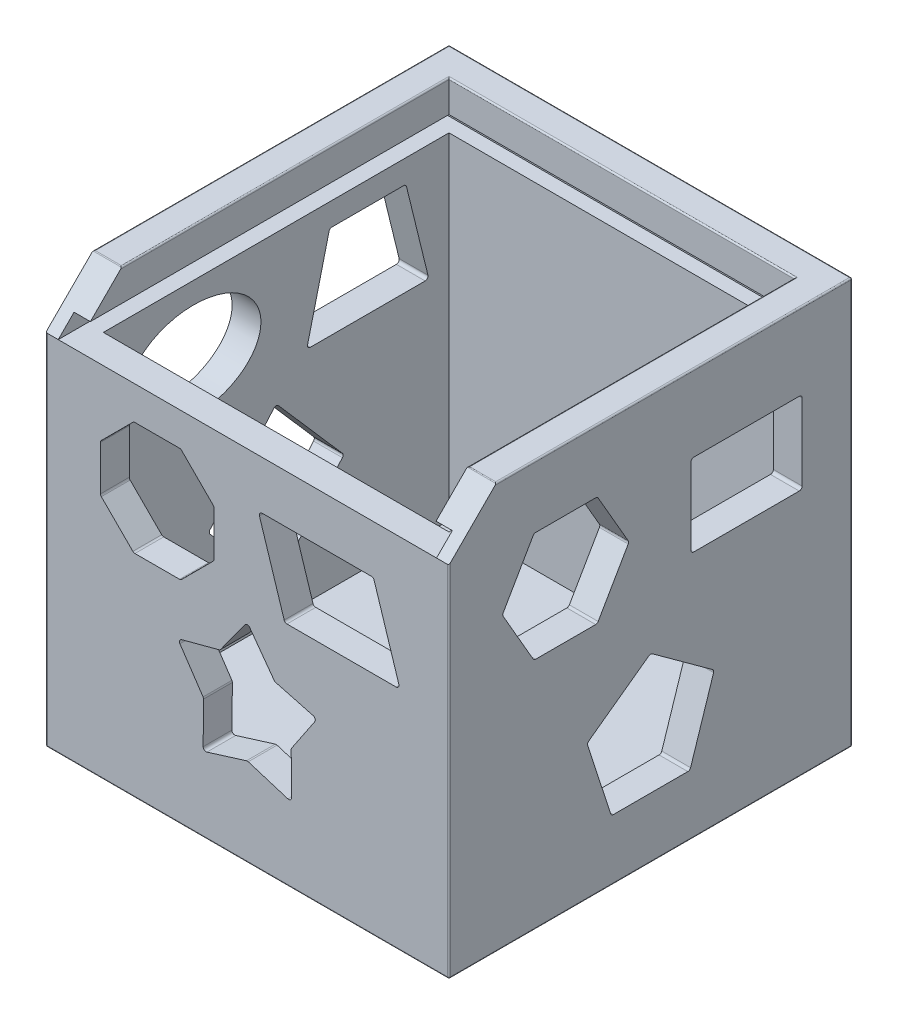
from build123d import *

# Parameters (mm, degrees)
SKETCH2_W           = 140
SKETCH2_H           = 140
BOSS_EXTRUDE1_DEPTH = 141
SKETCH3_W           = 120
SKETCH3_H           = 120
CUT_EXTRUDE1_DEPTH  = 133
SKETCH4_W           = 131.328549568
SKETCH4_H           = 5.5
CUT_EXTRUDE2_DEPTH  = 135
CUT_EXTRUDE3_DEPTH  = 211.667985228
CUT_EXTRUDE4_REACH  = 212.668
CUT_EXTRUDE5_REACH  = 212.668
SKETCH7_RX          = 23.35
SKETCH7_RY          = 16.8
CUT_EXTRUDE6_REACH  = 212.668
FILLET2_R           = 0.5
FILLET6_R           = 0.5
SKETCH10_W          = 120
SKETCH10_H          = 10.5
CUT_EXTRUDE7_DEPTH  = 131
FILLET7_R           = 0.5


with BuildPart() as part:
    # Sketch2 → Boss-Extrude1 (new body)
    with BuildSketch(Plane(origin=(0, 0, 0), x_dir=(1, 0, 0), z_dir=(0, 1, 0))):
        Rectangle(SKETCH2_W, SKETCH2_H)
    extrude(amount=BOSS_EXTRUDE1_DEPTH)

    # Sketch3 → Cut-Extrude1 (cut)
    with BuildSketch(Plane(origin=(0, 141, 0), x_dir=(1, 0, 0), z_dir=(0, 1, 0))):
        Rectangle(SKETCH3_W, SKETCH3_H)
    extrude(amount=-CUT_EXTRUDE1_DEPTH, mode=Mode.SUBTRACT)

    # Sketch4 → Cut-Extrude2 (cut)
    with BuildSketch(Plane.XY.offset(70)):
        with Locations((0, 127.25)):
            Rectangle(SKETCH4_W, SKETCH4_H)
    extrude(amount=-CUT_EXTRUDE2_DEPTH, mode=Mode.SUBTRACT)

    # Sketch5 → Cut-Extrude3 (cut, through all)
    with BuildSketch(Plane.ZY.offset(70)):
        Polygon((53.5, 141), (70, 124.5), (70, 141), align=None)
    extrude(amount=-CUT_EXTRUDE3_DEPTH, mode=Mode.SUBTRACT)

    # Sketch6 → Cut-Extrude4 (cut, up to next)
    with BuildSketch(Plane.XY.offset(70), mode=Mode.PRIVATE) as cut_extrude4_sk1:
        with BuildLine():
            Line((-11.6, 85.454206384), (-11.6, 100.945793616))
            ThreePointArc((-11.6, 100.945793616), (-11.676120467, 101.328477049), (-11.892893219, 101.652900398))
            Line((-11.892893219, 101.652900398), (-22.847099602, 112.607106781))
            ThreePointArc((-22.847099602, 112.607106781), (-23.171522951, 112.823879533), (-23.554206384, 112.9))
            Line((-23.554206384, 112.9), (-39.045793616, 112.9))
            ThreePointArc((-39.045793616, 112.9), (-39.428477049, 112.823879533), (-39.752900398, 112.607106781))
            Line((-39.752900398, 112.607106781), (-50.707106781, 101.652900398))
            ThreePointArc((-50.707106781, 101.652900398), (-50.923879533, 101.328477049), (-51, 100.945793616))
            Line((-51, 100.945793616), (-51, 85.454206384))
            ThreePointArc((-51, 85.454206384), (-50.923879533, 85.071522951), (-50.707106781, 84.747099602))
            Line((-50.707106781, 84.747099602), (-39.752900398, 73.792893219))
            ThreePointArc((-39.752900398, 73.792893219), (-39.428477049, 73.576120467), (-39.045793616, 73.5))
            Line((-39.045793616, 73.5), (-23.554206384, 73.5))
            ThreePointArc((-23.554206384, 73.5), (-23.171522951, 73.576120467), (-22.847099602, 73.792893219))
            Line((-22.847099602, 73.792893219), (-11.892893219, 84.747099602))
            ThreePointArc((-11.892893219, 84.747099602), (-11.676120467, 85.071522951), (-11.6, 85.454206384))
        make_face()
    cut_extrude4_tool1 = extrude(cut_extrude4_sk1.sketch, amount=-CUT_EXTRUDE4_REACH, mode=Mode.PRIVATE) & part.part
    # Sketch6 → Cut-Extrude4 (cut, up to next)
    with BuildSketch(Plane.XY.offset(70), mode=Mode.PRIVATE) as cut_extrude4_sk2:
        with BuildLine():
            Line((-15.359083662, 27.249175687), (-15.208454306, 41.645423645))
            ThreePointArc((-15.208454306, 41.645423645), (-15.250288115, 41.942281763), (-15.378232008, 42.213400131))
            Line((-15.378232008, 42.213400131), (-23.414818917, 54.180300077))
            ThreePointArc((-23.414818917, 54.180300077), (-23.520704727, 55.089672077), (-22.842019393, 55.704127491))
            Line((-22.842019393, 55.704127491), (-9.842019393, 59.166549034))
            ThreePointArc((-9.842019393, 59.166549034), (-9.53434867, 59.307798129), (-9.291438498, 59.543609979))
            Line((-9.291438498, 59.543609979), (-0.807948934, 71.175679843))
            ThreePointArc((-0.807948934, 71.175679843), (0, 71.586427333), (0.807948934, 71.175679843))
            Line((0.807948934, 71.175679843), (9.291438498, 59.543609979))
            ThreePointArc((9.291438498, 59.543609979), (9.53434867, 59.307798129), (9.842019393, 59.166549034))
            Line((9.842019393, 59.166549034), (22.842019393, 55.704127491))
            ThreePointArc((22.842019393, 55.704127491), (23.520704727, 55.089672077), (23.414818917, 54.180300077))
            Line((23.414818917, 54.180300077), (15.378232008, 42.213400131))
            ThreePointArc((15.378232008, 42.213400131), (15.250288115, 41.942281763), (15.208454306, 41.645423645))
            Line((15.208454306, 41.645423645), (15.359083662, 27.249175687))
            ThreePointArc((15.359083662, 27.249175687), (14.956308766, 26.436598738), (14.062355917, 26.283768052))
            Line((14.062355917, 26.283768052), (0.296782478, 30.561899811))
            ThreePointArc((0.296782478, 30.561899811), (0, 30.606954703), (-0.296782478, 30.561899811))
            Line((-0.296782478, 30.561899811), (-14.062355917, 26.283768052))
            ThreePointArc((-14.062355917, 26.283768052), (-14.956308766, 26.436598738), (-15.359083662, 27.249175687))
        make_face()
    cut_extrude4_tool2 = extrude(cut_extrude4_sk2.sketch, amount=-CUT_EXTRUDE4_REACH, mode=Mode.PRIVATE) & part.part
    # Sketch6 → Cut-Extrude4 (cut, up to next)
    with BuildSketch(Plane.XY.offset(70), mode=Mode.PRIVATE) as cut_extrude4_sk3:
        with BuildLine():
            Line((4.192722534, 106.396964853), (12.778374169, 79.396964853))
            ThreePointArc((12.778374169, 79.396964853), (13.141029549, 78.892833615), (13.73135355, 78.7))
            Line((13.73135355, 78.7), (51.632672255, 78.7))
            ThreePointArc((51.632672255, 78.7), (52.43983864, 79.109675999), (52.585651635, 80.003035147))
            Line((52.585651635, 80.003035147), (44, 107.003035147))
            ThreePointArc((44, 107.003035147), (43.637344621, 107.507166385), (43.04702062, 107.7))
            Line((43.04702062, 107.7), (5.145701914, 107.7))
            ThreePointArc((5.145701914, 107.7), (4.338535529, 107.290324001), (4.192722534, 106.396964853))
        make_face()
    cut_extrude4_tool3 = extrude(cut_extrude4_sk3.sketch, amount=-CUT_EXTRUDE4_REACH, mode=Mode.PRIVATE) & part.part
    add(cut_extrude4_tool1.solids().sort_by_distance((-31.3, 93.2, 70))[0], mode=Mode.SUBTRACT)
    add(cut_extrude4_tool2.solids().sort_by_distance((0, 46.589707, 70))[0], mode=Mode.SUBTRACT)
    add(cut_extrude4_tool3.solids().sort_by_distance((28.389187, 93.2, 70))[0], mode=Mode.SUBTRACT)

    # Sketch7 → Cut-Extrude5 (cut, up to next)
    with BuildSketch(Plane.ZY.offset(70), mode=Mode.PRIVATE) as cut_extrude5_sk1:
        with Locations(Location((28.65, 100.3), (0, 0, 180))):
            Ellipse(SKETCH7_RX, SKETCH7_RY)
    cut_extrude5_tool1 = extrude(cut_extrude5_sk1.sketch, amount=-CUT_EXTRUDE5_REACH, mode=Mode.PRIVATE) & part.part
    # Sketch7 → Cut-Extrude5 (cut, up to next)
    with BuildSketch(Plane.ZY.offset(70), mode=Mode.PRIVATE) as cut_extrude5_sk2:
        with BuildLine():
            Line((-51.724966278, 84.1), (-11.875033722, 84.1))
            ThreePointArc((-11.875033722, 84.1), (-11.088172379, 84.482870171), (-10.903842509, 85.338301548))
            Line((-10.903842509, 85.338301548), (-18.363101769, 115.738301548))
            ThreePointArc((-18.363101769, 115.738301548), (-18.717163152, 116.286861343), (-19.334292982, 116.5))
            Line((-19.334292982, 116.5), (-44.265707018, 116.5))
            ThreePointArc((-44.265707018, 116.5), (-44.882836848, 116.286861343), (-45.236898231, 115.738301548))
            Line((-45.236898231, 115.738301548), (-52.696157491, 85.338301548))
            ThreePointArc((-52.696157491, 85.338301548), (-52.511827621, 84.482870171), (-51.724966278, 84.1))
        make_face()
    cut_extrude5_tool2 = extrude(cut_extrude5_sk2.sketch, amount=-CUT_EXTRUDE5_REACH, mode=Mode.PRIVATE) & part.part
    # Sketch7 → Cut-Extrude5 (cut, up to next)
    with BuildSketch(Plane.ZY.offset(70), mode=Mode.PRIVATE) as cut_extrude5_sk3:
        with BuildLine():
            Line((0.753535335, 19.863719353), (22.982088168, 45.342592593))
            ThreePointArc((22.982088168, 45.342592593), (23.228552834, 46), (22.982088168, 46.657407407))
            Line((22.982088168, 46.657407407), (0.753535335, 72.136280647))
            ThreePointArc((0.753535335, 72.136280647), (0, 72.478873239), (-0.753535335, 72.136280647))
            Line((-0.753535335, 72.136280647), (-22.982088168, 46.657407407))
            ThreePointArc((-22.982088168, 46.657407407), (-23.228552834, 46), (-22.982088168, 45.342592593))
            Line((-22.982088168, 45.342592593), (-0.753535335, 19.863719353))
            ThreePointArc((-0.753535335, 19.863719353), (0, 19.521126761), (0.753535335, 19.863719353))
        make_face()
    cut_extrude5_tool3 = extrude(cut_extrude5_sk3.sketch, amount=-CUT_EXTRUDE5_REACH, mode=Mode.PRIVATE) & part.part
    add(cut_extrude5_tool1.solids().sort_by_distance((-70, 100.3, 28.65))[0], mode=Mode.SUBTRACT)
    add(cut_extrude5_tool2.solids().sort_by_distance((-70, 99.059866, -31.8))[0], mode=Mode.SUBTRACT)
    add(cut_extrude5_tool3.solids().sort_by_distance((-70, 46, 0))[0], mode=Mode.SUBTRACT)

    # Sketch9 → Cut-Extrude6 (cut, up to next)
    with BuildSketch(Plane(origin=(70, 0, 0), x_dir=(0, 0, -1), z_dir=(1, 0, 0)), mode=Mode.PRIVATE) as cut_extrude6_sk1:
        with BuildLine():
            Line((-12.920084714, 21), (12.920084714, 21))
            ThreePointArc((12.920084714, 21), (13.507869966, 21.190983006), (13.87114123, 21.690983006))
            Line((13.87114123, 21.690983006), (21.856192721, 46.266444522))
            ThreePointArc((21.856192721, 46.266444522), (21.856192721, 46.884478511), (21.492921457, 47.384478511))
            Line((21.492921457, 47.384478511), (0.587785252, 62.572949017))
            ThreePointArc((0.587785252, 62.572949017), (0, 62.763932023), (-0.587785252, 62.572949017))
            Line((-0.587785252, 62.572949017), (-21.492921457, 47.384478511))
            ThreePointArc((-21.492921457, 47.384478511), (-21.856192721, 46.884478511), (-21.856192721, 46.266444522))
            Line((-21.856192721, 46.266444522), (-13.87114123, 21.690983006))
            ThreePointArc((-13.87114123, 21.690983006), (-13.507869966, 21.190983006), (-12.920084714, 21))
        make_face()
    cut_extrude6_tool1 = extrude(cut_extrude6_sk1.sketch, amount=-CUT_EXTRUDE6_REACH, mode=Mode.PRIVATE) & part.part
    # Sketch9 → Cut-Extrude6 (cut, up to next)
    with BuildSketch(Plane(origin=(70, 0, 0), x_dir=(0, 0, -1), z_dir=(1, 0, 0)), mode=Mode.PRIVATE) as cut_extrude6_sk2:
        with BuildLine():
            Line((15, 114.5), (51.6, 114.5))
            ThreePointArc((51.6, 114.5), (52.307106781, 114.207106781), (52.6, 113.5))
            Line((52.6, 113.5), (52.6, 87))
            ThreePointArc((52.6, 87), (52.307106781, 86.292893219), (51.6, 86))
            Line((51.6, 86), (15, 86))
            ThreePointArc((15, 86), (14.292893219, 86.292893219), (14, 87))
            Line((14, 87), (14, 113.5))
            ThreePointArc((14, 113.5), (14.292893219, 114.207106781), (15, 114.5))
        make_face()
    cut_extrude6_tool2 = extrude(cut_extrude6_sk2.sketch, amount=-CUT_EXTRUDE6_REACH, mode=Mode.PRIVATE) & part.part
    # Sketch9 → Cut-Extrude6 (cut, up to next)
    with BuildSketch(Plane(origin=(70, 0, 0), x_dir=(0, 0, -1), z_dir=(1, 0, 0)), mode=Mode.PRIVATE) as cut_extrude6_sk3:
        with BuildLine():
            Line((-40.788675135, 118.802558883), (-51.211324865, 100.75))
            ThreePointArc((-51.211324865, 100.75), (-51.345299462, 100.25), (-51.211324865, 99.75))
            Line((-51.211324865, 99.75), (-40.788675135, 81.697441117))
            ThreePointArc((-40.788675135, 81.697441117), (-40.422649731, 81.331415713), (-39.922649731, 81.197441117))
            Line((-39.922649731, 81.197441117), (-19.077350269, 81.197441117))
            ThreePointArc((-19.077350269, 81.197441117), (-18.577350269, 81.331415713), (-18.211324865, 81.697441117))
            Line((-18.211324865, 81.697441117), (-7.788675135, 99.75))
            ThreePointArc((-7.788675135, 99.75), (-7.654700538, 100.25), (-7.788675135, 100.75))
            Line((-7.788675135, 100.75), (-18.211324865, 118.802558883))
            ThreePointArc((-18.211324865, 118.802558883), (-18.577350269, 119.168584287), (-19.077350269, 119.302558883))
            Line((-19.077350269, 119.302558883), (-39.922649731, 119.302558883))
            ThreePointArc((-39.922649731, 119.302558883), (-40.422649731, 119.168584287), (-40.788675135, 118.802558883))
        make_face()
    cut_extrude6_tool3 = extrude(cut_extrude6_sk3.sketch, amount=-CUT_EXTRUDE6_REACH, mode=Mode.PRIVATE) & part.part
    add(cut_extrude6_tool1.solids().sort_by_distance((70, 39.782971, 0))[0], mode=Mode.SUBTRACT)
    add(cut_extrude6_tool2.solids().sort_by_distance((70, 100.25, -33.3))[0], mode=Mode.SUBTRACT)
    add(cut_extrude6_tool3.solids().sort_by_distance((70, 100.25, 29.5))[0], mode=Mode.SUBTRACT)

    # Fillet2
    fillet2_edges = [part.edges().sort_by_distance(p)[0] for p in [
        (0, 141, -70),
        (-60, 141, -3.25),
        (0, 141, -60),
        (-70, 141, -8.25),
        (60, 141, -3.25),
        (70, 141, -8.25),
        (-65, 141, 53.5),
        (65, 141, 53.5),
    ]]
    fillet(fillet2_edges, radius=FILLET2_R)

    # Fillet6
    # the kernel refuses this fillet: 0.5 mm, written as the material it takes off along each edge
    with BuildSketch(Plane(origin=(-69.5, 140.5, -69.5), x_dir=(-1, 0, 0), z_dir=(0, 0, -1))) as fillet6_piece_1_section:
        Polygon((0, 0), (FILLET6_R, 0), (FILLET6_R, FILLET6_R), (0, FILLET6_R), align=None)
    fillet6_piece_1 = extrude(amount=FILLET6_R, mode=Mode.PRIVATE)
    fillet6_piece_1 = fillet6_piece_1 - Plane(origin=(-69.5, 140.5, -69.5), x_dir=(0.7071067811865475, -0.7071067811865475, 0), z_dir=(0, 0, -1)) * Sphere(FILLET6_R, mode=Mode.PRIVATE)
    add(fillet6_piece_1, mode=Mode.SUBTRACT)
    with BuildSketch(Plane(origin=(69.5, 140.5, -69.5), x_dir=(1, 0, 0), z_dir=(0, 0, -1))) as fillet6_piece_2_section:
        Polygon((0, 0), (FILLET6_R, 0), (FILLET6_R, -FILLET6_R), (0, -FILLET6_R), align=None)
    fillet6_piece_2 = extrude(amount=FILLET6_R, mode=Mode.PRIVATE)
    fillet6_piece_2 = fillet6_piece_2 - Plane(origin=(69.5, 140.5, -69.5), x_dir=(-0.7071067811865475, -0.7071067811865475, 0), z_dir=(0, 0, -1)) * Sphere(FILLET6_R, mode=Mode.PRIVATE)
    add(fillet6_piece_2, mode=Mode.SUBTRACT)
    with BuildSketch(Plane(origin=(-70, -1.25, -70), x_dir=(1, 0, 0), z_dir=(0, 1, 0))) as fillet6_piece_3:
        with BuildLine():
            CenterArc((FILLET6_R, -FILLET6_R), FILLET6_R, 90, 90)
            Line((0, -FILLET6_R), (0, 0))
            Line((0, 0), (FILLET6_R, 0))
        make_face()
    extrude(amount=141.75, mode=Mode.SUBTRACT)
    with BuildSketch(Plane(origin=(70, -1.25, -70), x_dir=(-1, 0, 0), z_dir=(0, 1, 0))) as fillet6_piece_4:
        with BuildLine():
            CenterArc((FILLET6_R, FILLET6_R), FILLET6_R, 180, 90)
            Line((0, FILLET6_R), (0, 0))
            Line((0, 0), (FILLET6_R, 0))
        make_face()
    extrude(amount=141.75, mode=Mode.SUBTRACT)
    with BuildSketch(Plane(origin=(70, -1.25, 70), x_dir=(0, 0, -1), z_dir=(0, 1, 0))) as fillet6_piece_5:
        with BuildLine():
            CenterArc((FILLET6_R, FILLET6_R), FILLET6_R, 180, 90)
            Line((0, FILLET6_R), (0, 0))
            Line((0, 0), (FILLET6_R, 0))
        make_face()
    extrude(amount=127, mode=Mode.SUBTRACT)
    with BuildSketch(Plane(origin=(-70, -1.25, 70), x_dir=(0, 0, -1), z_dir=(0, 1, 0))) as fillet6_piece_6:
        with BuildLine():
            CenterArc((FILLET6_R, -FILLET6_R), FILLET6_R, 90, 90)
            Line((0, -FILLET6_R), (0, 0))
            Line((0, 0), (FILLET6_R, 0))
        make_face()
    extrude(amount=127, mode=Mode.SUBTRACT)

    # Sketch10 → Cut-Extrude7 (cut)
    with BuildSketch(Plane.XY.offset(-60)):
        with Locations((0, 135.25)):
            Rectangle(SKETCH10_W, SKETCH10_H)
    extrude(amount=CUT_EXTRUDE7_DEPTH, mode=Mode.SUBTRACT)

    # Fillet7
    fillet7_edges = [part.edges().sort_by_distance(p)[0] for p in [
        (0, 0, 70),
        (-70, 0, 0),
        (0, 0, -70),
        (70, 0, 0),
        (-69.853553391, 0, -69.853553391),
        (69.853553391, 0, -69.853553391),
        (69.853553391, 0, 69.853553391),
        (-69.853553391, 0, 69.853553391),
    ]]
    fillet(fillet7_edges, radius=FILLET7_R)


solid = part.part
